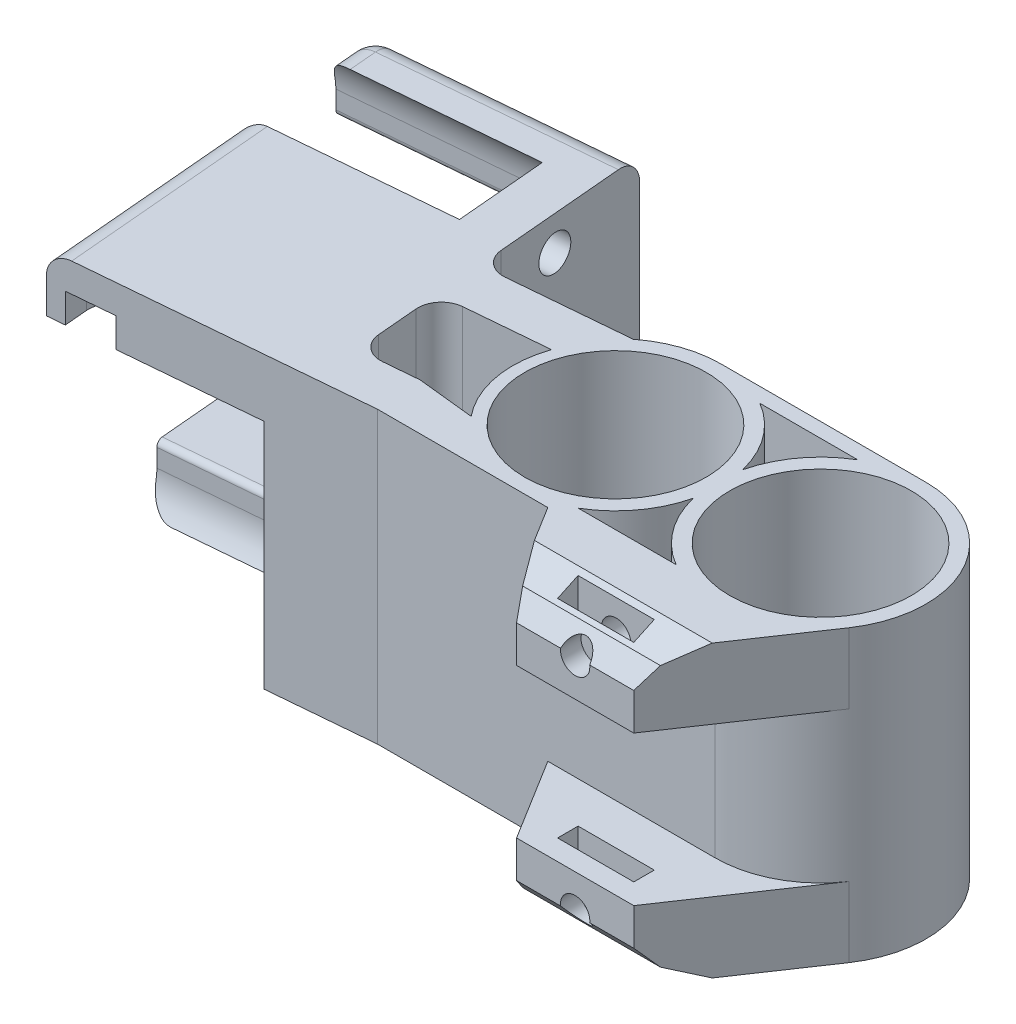
from build123d import *

# Parameters (mm, degrees)
SKETCH1_R               = 7.75
BOSS_EXTRUDE1_DEPTH     = 24
BOSS_EXTRUDE2_START     = 0.75
SKETCH2_R               = 4.33
BOSS_EXTRUDE2_DEPTH     = 0.75
SKETCH4_W               = 10
SKETCH4_H               = 6
BOSS_EXTRUDE4_DEPTH     = 7
CUT_EXTRUDE1_DEPTH      = 37.191331835
CUT_EXTRUDE1_DEPTH_BACK = 37.191331835
SKETCH5_W               = 6.5
SKETCH5_H               = 1.75
SKETCH6_R               = 1.25
CUT_EXTRUDE2_DEPTH      = 19
BOSS_EXTRUDE5_START     = -24.75
BOSS_EXTRUDE5_DEPTH     = 24.75
CUT_EXTRUDE3_DEPTH      = 40.633477011
SKETCH9_W               = 15
SKETCH9_H               = 24.75
BOSS_EXTRUDE6_DEPTH     = 4
FILLET1_R               = 2
FILLET2_R               = 2
BOSS_EXTRUDE9_DEPTH     = 17.13
SKETCH14_R              = 1.5
CUT_EXTRUDE5_DEPTH      = 6
BOSS_EXTRUDE10_DEPTH    = 14.84
FILLET4_R               = 2
SKETCH16_W              = 4
SKETCH16_H              = 2.5
CUT_EXTRUDE6_DEPTH      = 4
FILLET5_R               = 2
BOSS_EXTRUDE11_DEPTH    = 6
BOSS_EXTRUDE12_START    = -6
BOSS_EXTRUDE12_DEPTH    = 6
CHAMFER1_SIZE           = 4
CHAMFER1_SIZE_2         = 1.865230633


with BuildPart() as part:
    # Sketch1 → Boss-Extrude1 (new body)
    with BuildSketch(Plane(origin=(0, 0, 0), x_dir=(1, 0, 0), z_dir=(0, 1, 0))):
        with BuildLine():
            Line((0, -9), (17.5, -9))
            ThreePointArc((17.5, -9), (26.5, 0), (17.5, 9))
            Line((17.5, 9), (0, 9))
            ThreePointArc((0, 9), (-9, 0), (0, -9))
        make_face()
        with Locations(Location((17.5, 0, 0), (0, 0, 270))):
            Circle(SKETCH1_R, mode=Mode.SUBTRACT)
        with BuildLine():
            ThreePointArc((8.75, -2.106537443), (10.26424991, -5.352001554), (12.924248696, -7.75))
            Line((12.924248696, -7.75), (4.575751304, -7.75))
            ThreePointArc((4.575751304, -7.75), (7.23575009, -5.352001554), (8.75, -2.106537443))
        make_face(mode=Mode.SUBTRACT)
        with Locations(Location((0, 0, 0), (0, 0, 270))):
            Circle(SKETCH1_R, mode=Mode.SUBTRACT)
        with BuildLine():
            Line((4.575751304, 7.75), (12.924248696, 7.75))
            ThreePointArc((12.924248696, 7.75), (10.26424991, 5.352001554), (8.75, 2.106537443))
            ThreePointArc((8.75, 2.106537443), (7.23575009, 5.352001554), (4.575751304, 7.75))
        make_face(mode=Mode.SUBTRACT)
    extrude(amount=BOSS_EXTRUDE1_DEPTH)

    # Sketch2 → Boss-Extrude2 (add)
    with BuildSketch(Plane.XZ.offset(BOSS_EXTRUDE2_START)):
        with BuildLine():
            Line((17.5, 9), (0, 9))
            ThreePointArc((0, 9), (-9, 0), (0, -9))
            Line((0, -9), (17.5, -9))
            ThreePointArc((17.5, -9), (26.5, 0), (17.5, 9))
        make_face()
        with Locations(Location((17.5, 0, 0), (0, 0, 270))):
            Circle(SKETCH2_R, mode=Mode.SUBTRACT)
        with Locations(Location((0, 0, 0), (0, 0, 270))):
            Circle(SKETCH2_R, mode=Mode.SUBTRACT)
    extrude(amount=-BOSS_EXTRUDE2_DEPTH)

    # Sketch4 → Boss-Extrude4 (add)
    with BuildSketch(Plane.XY.offset(9)):
        with Locations((12.5625, 2.25)):
            Rectangle(SKETCH4_W, SKETCH4_H)
        with Locations((12.5625, 21)):
            Rectangle(SKETCH4_W, SKETCH4_H)
    extrude(amount=BOSS_EXTRUDE4_DEPTH)

    # Sketch5 → Cut-Extrude1 (cut, two sides: drawn at the far end of the back side and taken through both)
    with BuildSketch(Plane.XZ.offset(-18).offset(-CUT_EXTRUDE1_DEPTH_BACK)):
        with Locations((12.5625, 13.375)):
            Rectangle(SKETCH5_W, SKETCH5_H)
    extrude(amount=CUT_EXTRUDE1_DEPTH + CUT_EXTRUDE1_DEPTH_BACK, mode=Mode.SUBTRACT)

    # Sketch6 → Cut-Extrude2 (cut)
    with BuildSketch(Plane.XY.offset(16)):
        with Locations((12.5625, 2.25)):
            Circle(SKETCH6_R)
        with Locations((12.5625, 21)):
            Circle(SKETCH6_R)
    extrude(amount=-CUT_EXTRUDE2_DEPTH, mode=Mode.SUBTRACT)

    # Sketch7 → Boss-Extrude5 (add)
    with BuildSketch(Plane(origin=(0, 24, 0), x_dir=(1, 0, 0), z_dir=(0, 1, 0)).offset(BOSS_EXTRUDE5_START)):
        with BuildLine():
            Line((-20.224515403, -9.780709308), (-11.300967177, -9))
            Line((-11.300967177, -9), (0, -9))
            ThreePointArc((0, -9), (-8.505937794, -2.940922006), (-5.558955476, 7.077995056))
            Line((-5.558955476, 7.077995056), (-21.576855644, 5.676610378))
            Line((-21.576855644, 5.676610378), (-20.224515403, -9.780709308))
        make_face()
    extrude(amount=BOSS_EXTRUDE5_DEPTH)

    # Sketch8 → Cut-Extrude3 (cut, through all)
    with BuildSketch(Plane(origin=(0, 24, 0), x_dir=(1, 0, 0), z_dir=(0, 1, 0))):
        with BuildLine():
            Line((-16.588359581, -5.447307545), (-11.649590148, -5.015221208))
            Line((-11.649590148, -5.015221208), (-6.776158873, -5.535898385))
            ThreePointArc((-6.776158873, -5.535898385), (-8.611505528, -1.550636174), (-8.281582293, 2.824516725))
            Line((-8.281582293, 2.824516725), (-17.24345388, 2.040454557))
            Line((-17.24345388, 2.040454557), (-16.588359581, -5.447307545))
        make_face()
    extrude(amount=-CUT_EXTRUDE3_DEPTH, mode=Mode.SUBTRACT)

    # Sketch9 → Boss-Extrude6 (add)
    with BuildSketch(Plane(origin=(-20.92008866, 0, 1.830270598), x_dir=(0.08715574274765853, 0, 0.9961946980917455), z_dir=(-0.9961946980917455, 0, 0.08715574274765853))):
        with Locations((-15.035556042, 11.625)):
            Rectangle(SKETCH9_W, SKETCH9_H)
    extrude(amount=-BOSS_EXTRUDE6_DEPTH)

    # Fillet1
    fillet1_edges = [part.edges().sort_by_distance(p)[0] for p in [
        (-16.588359581, 11.625, 5.447307545),
        (-17.24345388, 11.625, -2.040454557),
        (-17.592076851, 11.625, -6.025233349),
    ]]
    fillet(fillet1_edges, radius=FILLET1_R)

    # Fillet2
    fillet2_edges = [part.edges().sort_by_distance(p)[0] for p in [
        (-20.891802389, -0.75, -20.793842335),
        (-20.891802389, 24, -20.793842335),
    ]]
    fillet(fillet2_edges, radius=FILLET2_R)

    # Sketch13 → Boss-Extrude9 (add)
    with BuildSketch(Plane(origin=(-20.92008866, 0, 1.830270598), x_dir=(0.08715574274765853, 0, 0.9961946980917455), z_dir=(-0.9961946980917455, 0, 0.08715574274765853))):
        with BuildLine():
            Line((-9.345556042, 21.08), (-9.345556042, 19.545))
            ThreePointArc((-9.345556042, 19.545), (-9.199109432, 19.191446609), (-8.845556042, 19.045))
            Line((-8.845556042, 19.045), (7.980808095, 19.045))
            Line((7.980808095, 19.045), (7.980808095, 24))
            Line((7.980808095, 24), (-10.383882792, 24))
            ThreePointArc((-10.383882792, 24), (-9.612862341, 22.629558198), (-9.345556042, 21.08))
        make_face()
        with BuildLine():
            Line((-22.535556042, 19.045), (-19.695556042, 19.045))
            ThreePointArc((-19.695556042, 19.045), (-19.342002651, 19.191446609), (-19.195556042, 19.545))
            Line((-19.195556042, 19.545), (-19.195556042, 21.08))
            ThreePointArc((-19.195556042, 21.08), (-18.928249742, 22.629558198), (-18.157229291, 24))
            Line((-18.157229291, 24), (-20.535556042, 24))
            ThreePointArc((-20.535556042, 24), (-21.949769604, 23.414213562), (-22.535556042, 22))
            Line((-22.535556042, 22), (-22.535556042, 19.045))
        make_face()
        with BuildLine():
            Line((-20.535556042, -0.75), (-1.357229291, -0.75))
            ThreePointArc((-1.357229291, -0.75), (-2.128249742, 0.620441802), (-2.395556042, 2.17))
            Line((-2.395556042, 2.17), (-2.395556042, 3.705))
            ThreePointArc((-2.395556042, 3.705), (-2.542002651, 4.058553391), (-2.895556042, 4.205))
            Line((-2.895556042, 4.205), (-22.535556042, 4.205))
            Line((-22.535556042, 4.205), (-22.535556042, 1.25))
            ThreePointArc((-22.535556042, 1.25), (-21.949769604, -0.164213562), (-20.535556042, -0.75))
        make_face()
    extrude(amount=BOSS_EXTRUDE9_DEPTH)

    # Sketch14 → Cut-Extrude5 (cut)
    with BuildSketch(Plane(origin=(-20.92008866, 0, 1.830270598), x_dir=(0.08715574274765853, 0, 0.9961946980917455), z_dir=(-0.9961946980917455, 0, 0.08715574274765853))):
        with Locations((-14.570556042, 21.08)):
            Circle(SKETCH14_R)
        with Locations((2.829443958, 2.17)):
            Circle(SKETCH14_R)
    extrude(amount=-CUT_EXTRUDE5_DEPTH, mode=Mode.SUBTRACT)

    # Sketch15 → Boss-Extrude10 (add)
    with BuildSketch(Plane.XZ.offset(-19.045)):
        with BuildLine():
            ThreePointArc((-22.789759857, -19.540168975), (-23.288136954, -20.138127743), (-23.963553659, -20.525098922))
            Line((-23.963553659, -20.525098922), (-22.884191785, -20.619530849))
            Line((-22.884191785, -20.619530849), (-22.789759857, -19.540168975))
        make_face()
    extrude(amount=BOSS_EXTRUDE10_DEPTH)

    # Fillet4
    fillet4_edges = [part.edges().sort_by_distance(p)[0] for p in [
        (-38.089624718, 24, 2.126283335),
        (-38.938944821, -0.75, -7.581489867),
        (-39.897952311, -0.164213562, -18.542995633),
        (-39.949006963, 2.7275, -19.126552976),
        (-39.949006963, 20.5225, -19.126552976),
        (-39.897952311, 23.414213562, -18.542995633),
        (-39.671053061, 24, -15.94952533),
    ]]
    fillet(fillet4_edges, radius=FILLET4_R)

    # Sketch16 → Cut-Extrude6 (cut)
    with BuildSketch(Plane(origin=(0.695573257, 0, 7.95043871), x_dir=(0.9961946980917455, 0, -0.08715574274765835), z_dir=(0.08715574274765836, 0, 0.9961946980917457))):
        with Locations((-34.63, 20.295)):
            Rectangle(SKETCH16_W, SKETCH16_H)
    extrude(amount=-CUT_EXTRUDE6_DEPTH, mode=Mode.SUBTRACT)

    # Fillet5
    fillet5_edges = [part.edges().sort_by_distance(p)[0] for p in [
        (-36.143661505, 20.295, 7.158174775),
        (-34.151272109, 21.545, 6.983863289),
    ]]
    fillet(fillet5_edges, radius=FILLET5_R)

    # Sketch17 → Boss-Extrude11 (add)
    with BuildSketch(Plane.XZ.offset(0.75)):
        Polygon((7.5625, 9), (7.5625, 16), (3.229952148, 9), align=None)
        with BuildLine():
            Line((24.960920157, 5.033355781), (17.5625, 16))
            Line((17.5625, 16), (17.5625, 9))
            Line((17.5625, 9), (17.5, 9))
            ThreePointArc((17.5, 9), (21.72491408, 7.946703783), (24.960920157, 5.033355781))
        make_face()
    extrude(amount=-BOSS_EXTRUDE11_DEPTH)

    # Sketch18 → Boss-Extrude12 (add)
    with BuildSketch(Plane(origin=(0, 24, 0), x_dir=(1, 0, 0), z_dir=(0, 1, 0)).offset(BOSS_EXTRUDE12_START)):
        with BuildLine():
            Line((17.5625, -9), (17.5625, -16))
            Line((17.5625, -16), (24.960920157, -5.033355781))
            ThreePointArc((24.960920157, -5.033355781), (21.72491408, -7.946703783), (17.5, -9))
            Line((17.5, -9), (17.5625, -9))
        make_face()
        Polygon((7.5625, -9), (3.229952148, -9), (7.5625, -16), align=None)
    extrude(amount=BOSS_EXTRUDE12_DEPTH)

    # Chamfer1
    # the kernel refuses this chamfer: 4, 1.865230633 mm, written as the material it takes off along each edge
    with BuildSketch(Plane(origin=(27.926401886, 24, 16), x_dir=(0, 0.01631116413111048, -0.9998669641130704), z_dir=(-1, 0, 0))) as chamfer1_piece_1:
        Polygon((CHAMFER1_SIZE * 0.999866964113, CHAMFER1_SIZE * 0.0163111641311), (-CHAMFER1_SIZE_2 * 0.0163111641278, CHAMFER1_SIZE_2 * 0.999866963909), (0, 0), align=None)
    extrude(amount=30.727803771, mode=Mode.SUBTRACT)
    with BuildSketch(Plane(origin=(27.926401886, -0.75, 16), x_dir=(0, -0.016311164131110376, -0.9998669641130704), z_dir=(-1, 0, 0))) as chamfer1_piece_2:
        Polygon((CHAMFER1_SIZE * 0.999866964113, -CHAMFER1_SIZE * 0.0163111641311), (-CHAMFER1_SIZE_2 * 0.0163111641278, -CHAMFER1_SIZE_2 * 0.999866963909), (0, 0), align=None)
    extrude(amount=30.727803771, mode=Mode.SUBTRACT)

    # Chamfer2
    # the kernel refuses this chamfer: 1.5, 0.986215949 mm, written as the material it takes off along each edge
    with BuildSketch(Plane(origin=(26.890011697, 22.134769367, 16), x_dir=(0, 0.4373449734128785, -0.8992938197444085), z_dir=(-1, 0, 0))) as chamfer2_piece_1:
        with BuildLine():
            Line((1.554585283, 0), (-0.486101425, 0.911364654))
            Line((-0.486101425, 0.911364654), (-0.513080239, 0.898244305))
            ThreePointArc((-0.513080239, 0.898244305), (-0.252687879, 0.450995576), (-0.026978815, -0.013120349))
            Line((-0.026978815, -0.013120349), (0.000489335, -0.029996009))
            ThreePointArc((0.000489335, -0.029996009), (0.777575174, -0.017319148), (1.555074618, -0.029996009))
            Line((1.555074618, -0.029996009), (1.554585283, 0))
        make_face()
    extrude(amount=23.130811144, mode=Mode.SUBTRACT)
    with BuildSketch(Plane(origin=(26.890011697, 1.115230633, 16), x_dir=(0, -0.4373449734128783, -0.8992938197444086), z_dir=(-1, 0, 0))) as chamfer2_piece_2:
        with BuildLine():
            Line((1.554585283, 0), (-0.486101425, -0.911364654))
            Line((-0.486101425, -0.911364654), (-0.513080239, -0.898244305))
            ThreePointArc((-0.513080239, -0.898244305), (-0.252687879, -0.450995576), (-0.026978815, 0.013120349))
            Line((-0.026978815, 0.013120349), (0.000489335, 0.029996009))
            ThreePointArc((0.000489335, 0.029996009), (0.777575174, 0.017319148), (1.555074618, 0.029996009))
            Line((1.555074618, 0.029996009), (1.554585283, 0))
        make_face()
    extrude(amount=23.130811144, mode=Mode.SUBTRACT)


solid = part.part
